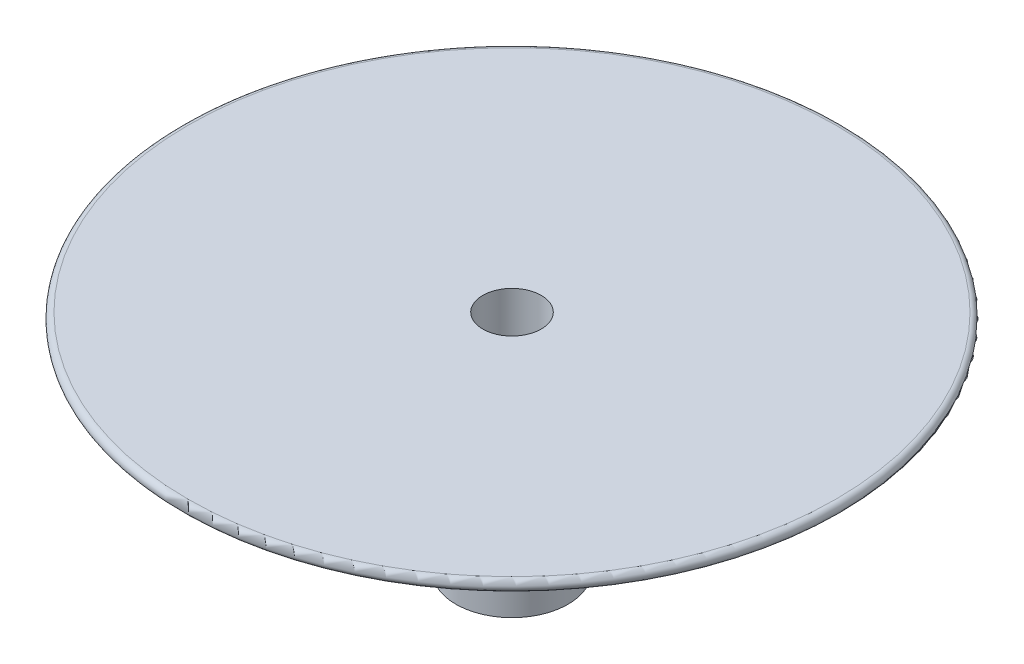
from build123d import *

# Parameters (mm, degrees)
SKETCH2_R          = 2.6
CUT_EXTRUDE1_DEPTH = 48.328372824
FILLET1_R          = 0.5


with BuildPart() as part:
    # Sketch1 → Revolve1 (revolve)
    with BuildSketch(Plane.XY):
        with BuildLine():
            Line((0, 10), (0, 0))
            Line((0, 0), (0, -10))
            Line((0, -10), (5, -10))
            Line((5, -10), (5, 0))
            ThreePointArc((5, 0), (18.359605006, 3.242115389), (30.331294682, 10))
            Line((30.331294682, 10), (0, 10))
        make_face()
    revolve(axis=Axis((0, 10, 0), (0, -1, 0)))

    # Sketch2 → Cut-Extrude1 (cut, through all)
    with BuildSketch(Plane(origin=(0, 10, 0), x_dir=(1, 0, 0), z_dir=(0, 1, 0))):
        Circle(SKETCH2_R)
    extrude(amount=-CUT_EXTRUDE1_DEPTH, mode=Mode.SUBTRACT)

    # Fillet1
    fillet1_edges = [part.edges().sort_by_distance(p)[0] for p in [
        (-30.331294682, 10, 0),
    ]]
    fillet(fillet1_edges, radius=FILLET1_R)


solid = part.part
